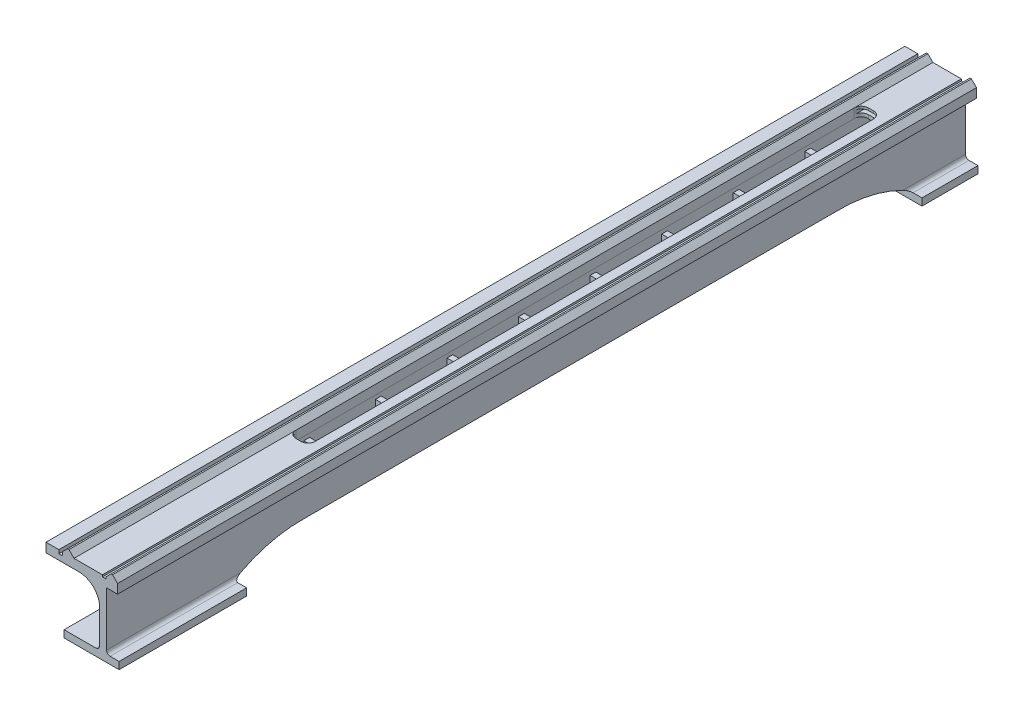
from build123d import *

# Parameters (mm, degrees)
BOSS_EXTRUDE1_DEPTH     = 1200
CUT_EXTRUDE1_DEPTH      = 800
CUT_EXTRUDE2_START      = -300
SKETCH3_W               = 32.854587933
SKETCH3_H               = 4.856765172
CUT_EXTRUDE2_DEPTH      = 900
SKETCH5_W               = 6.380456207
SKETCH5_H               = 87.231311729
BOSS_EXTRUDE2_DEPTH     = 1100
SKETCH6_W               = 8.096006647
SKETCH6_H               = 64.029540506
BOSS_EXTRUDE3_DEPTH     = 50
LPATTERN1_COUNT         = 10
LPATTERN1_PITCH         = 100
CUT_EXTRUDE3_DEPTH      = 10
CUT_EXTRUDE3_DEPTH_BACK = 100


with BuildPart() as part:
    # Sketch1 → Boss-Extrude1 (new body)
    with BuildSketch(Plane.XY):
        with BuildLine():
            Line((-33.312849815, 35.465206841), (-40.383917627, 42.536274653))
            Line((-40.383917627, 42.536274653), (-42.383917627, 42.536274653))
            Line((-42.383917627, 42.536274653), (-49.454985438, 35.465206841))
            Line((-49.454985438, 35.465206841), (-49.454985438, 32.891034548))
            Line((-49.454985438, 32.891034548), (-54.454985438, 32.891034548))
            Line((-54.454985438, 32.891034548), (-54.454985438, 35.465206841))
            Line((-54.454985438, 35.465206841), (-94.170714191, 35.465206841))
            Line((-94.170714191, 35.465206841), (-101.241782003, 42.536274653))
            Line((-101.241782003, 42.536274653), (-103.241782003, 42.536274653))
            Line((-103.241782003, 42.536274653), (-110.312849815, 35.465206841))
            Line((-110.312849815, 35.465206841), (-110.312849815, 30.48184999))
            Line((-110.312849815, 30.48184999), (-115.312849815, 30.48184999))
            Line((-115.312849815, 30.48184999), (-115.312849815, 35.465206841))
            Line((-115.312849815, 35.465206841), (-133.312849815, 35.465206841))
            Line((-133.312849815, 35.465206841), (-133.312849815, 22.536274653))
            Line((-133.312849815, 22.536274653), (-87.349569261, 22.536274653))
            ThreePointArc((-87.349569261, 22.536274653), (-68.862935324, 15.951815624), (-58.701074529, -0.836493409))
            Line((-58.701074529, -0.836493409), (-58.701074529, -52.793826888))
            ThreePointArc((-58.701074529, -52.793826888), (-60.165540623, -56.329360794), (-63.701074529, -57.793826888))
            Line((-63.701074529, -57.793826888), (-108.009983562, -57.793826888))
            Line((-108.009983562, -57.793826888), (-108.009983562, -67.793826888))
            Line((-108.009983562, -67.793826888), (-31.195424592, -67.793826888))
            Line((-31.195424592, -67.793826888), (-31.195424592, -57.793826888))
            Line((-31.195424592, -57.793826888), (-43.701074529, -57.793826888))
            ThreePointArc((-43.701074529, -57.793826888), (-47.236608435, -56.329360794), (-48.701074529, -52.793826888))
            Line((-48.701074529, -52.793826888), (-48.701074529, 22.536274653))
            Line((-48.701074529, 22.536274653), (-33.312849815, 22.536274653))
            Line((-33.312849815, 22.536274653), (-33.312849815, 35.465206841))
        make_face()
    extrude(amount=BOSS_EXTRUDE1_DEPTH)

    # Sketch2 → Cut-Extrude1 (cut)
    with BuildSketch(Plane(origin=(0, 20.764722339, 0), x_dir=(1, 0, 0), z_dir=(0, 1, 0))):
        with BuildLine():
            Line((-84.170689991, -100), (-77.170689991, -100))
            ThreePointArc((-77.170689991, -100), (-70.099622179, -102.928932188), (-67.170689991, -110))
            Line((-67.170689991, -110), (-67.170689991, -890))
            ThreePointArc((-67.170689991, -890), (-70.099622179, -897.071067812), (-77.170689991, -900))
            Line((-77.170689991, -900), (-84.170689991, -900))
            ThreePointArc((-84.170689991, -900), (-91.241757803, -897.071067812), (-94.170689991, -890))
            Line((-94.170689991, -890), (-94.170689991, -110))
            ThreePointArc((-94.170689991, -110), (-91.241757803, -102.928932188), (-84.170689991, -100))
        make_face()
    extrude(amount=CUT_EXTRUDE1_DEPTH, mode=Mode.SUBTRACT)

    # Sketch3 → Cut-Extrude2 (cut)
    with BuildSketch(Plane.XY.offset(1200).offset(CUT_EXTRUDE2_START)):
        with Locations((-77.540218065, 29.748880781)):
            Rectangle(SKETCH3_W, SKETCH3_H)
    extrude(amount=-CUT_EXTRUDE2_DEPTH, mode=Mode.SUBTRACT)

    # Sketch5 → Boss-Extrude2 (add)
    with BuildSketch(Plane(origin=(0, 0, 0), x_dir=(-1, 0, 0), z_dir=(0, 0, -1))):
        with Locations((98.110047032, -15.819004222)):
            Rectangle(SKETCH5_W, SKETCH5_H)
    extrude(amount=-BOSS_EXTRUDE2_DEPTH)

    # Sketch6 → Boss-Extrude3 (add)
    with BuildSketch(Plane.ZY.offset(101.300275135)):
        with Locations((74.203555632, -15.430068515)):
            Rectangle(SKETCH6_W, SKETCH6_H)
    boss_extrude3 = extrude(amount=-BOSS_EXTRUDE3_DEPTH)

    # LPattern1: Boss-Extrude3 ×10
    with Locations(*[(0, 0, i * LPATTERN1_PITCH) for i in range(1, LPATTERN1_COUNT)]):
        add(boss_extrude3)

    # Sketch4 → Cut-Extrude3 (cut, two sides: drawn at the far end of the back side and taken through both)
    with BuildSketch(Plane(origin=(-33.312849815, 0, 0), x_dir=(0, 0, -1), z_dir=(1, 0, 0)).offset(-CUT_EXTRUDE3_DEPTH_BACK)):
        with BuildLine():
            Line((-1021.794598087, -57.793826888), (-1021.794598087, -67.793826888))
            Line((-1021.794598087, -67.793826888), (-1021.794598087, -177.956634241))
            Line((-1021.794598087, -177.956634241), (-78.251558955, -177.956634241))
            Line((-78.251558955, -177.956634241), (-78.251558955, -57.793826888))
            ThreePointArc((-78.251558955, -57.793826888), (-127.370436685, -37.775297342), (-180.068799532, -31.75132623))
            Line((-180.068799532, -31.75132623), (-924.318449906, -31.75132623))
            ThreePointArc((-924.318449906, -31.75132623), (-974.883951061, -37.932582441), (-1021.794598087, -57.793826888))
        make_face()
    extrude(amount=CUT_EXTRUDE3_DEPTH + CUT_EXTRUDE3_DEPTH_BACK, mode=Mode.SUBTRACT)


solid = part.part
